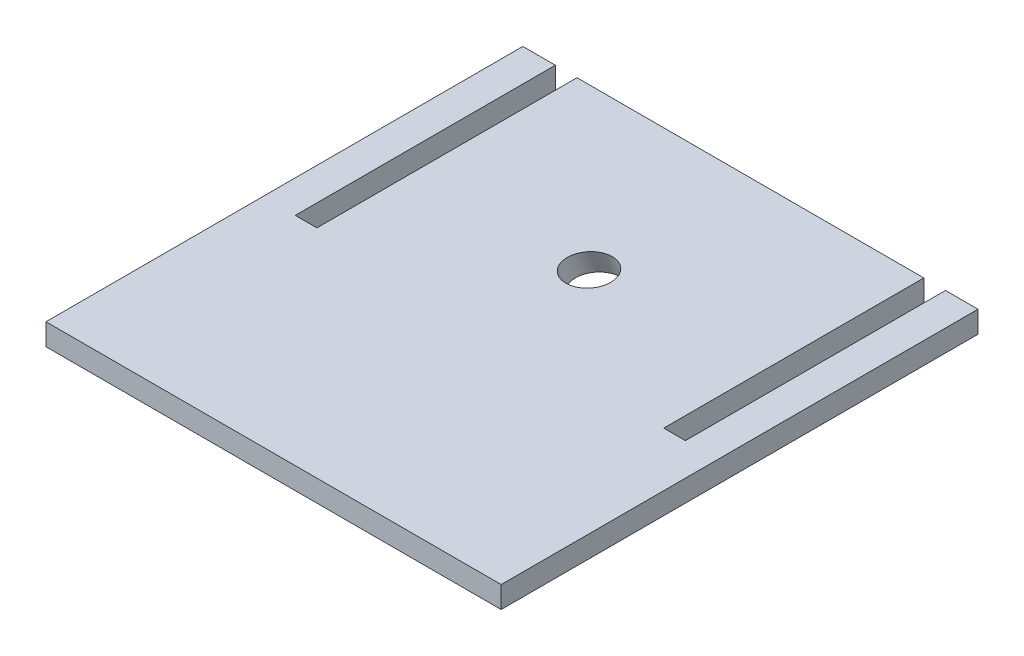
from build123d import *

# Parameters (mm, degrees)
SKETCH1_W           = 330.2
SKETCH1_H           = 279.4
BOSS_EXTRUDE1_DEPTH = 6.35
SKETCH2_W           = 12.7
SKETCH2_H           = 152.4
CUT_EXTRUDE1_DEPTH  = 217.645770787
SKETCH4_W           = 31.75
SKETCH4_H           = 279.4
CUT_EXTRUDE3_DEPTH  = 217.645770787
CAVITY1_START       = 5.359214582
CAVITY1_OUTLINE_R   = 12.7
CAVITY1_DEPTH       = 23.121998378


# Read off the part's stored shape, not the designer's step: Cavity1
with BuildPart() as part:
    # Sketch1 → Boss-Extrude1 (new, symmetric)
    with BuildSketch(Plane(origin=(0, 0, 0), x_dir=(1, 0, 0), z_dir=(0, 1, 0))):
        Rectangle(SKETCH1_W, SKETCH1_H)
    extrude(amount=BOSS_EXTRUDE1_DEPTH, both=True)

    # Sketch2 → Cut-Extrude1 (cut, through all)
    with BuildSketch(Plane(origin=(0, 6.35, 0), x_dir=(1, 0, 0), z_dir=(0, 1, 0))):
        with Locations((-107.95, 63.5)):
            Rectangle(SKETCH2_W, SKETCH2_H)
        with Locations((107.95, 63.5)):
            Rectangle(SKETCH2_W, SKETCH2_H)
    extrude(amount=-CUT_EXTRUDE1_DEPTH, mode=Mode.SUBTRACT)

    # Sketch4 → Cut-Extrude3 (cut, through all)
    with BuildSketch(Plane(origin=(0, 6.35, 0), x_dir=(1, 0, 0), z_dir=(0, 1, 0))):
        with Locations((-149.225, 0)):
            Rectangle(SKETCH4_W, SKETCH4_H)
        with Locations((149.225, 0)):
            Rectangle(SKETCH4_W, SKETCH4_H)
    extrude(amount=-CUT_EXTRUDE3_DEPTH, mode=Mode.SUBTRACT)

    # Cavity1 outline → Cavity1 (cut)
    with BuildSketch(Plane(origin=(0, 0, 0), x_dir=(0.9999723528488756, 0.006960139267343344, 0.002617250324818831), z_dir=(0.0074359624719049664, -0.9359846644758758, -0.35196223423557627)).offset(CAVITY1_START)):
        with Locations((-0.653273782, -45.008151356)):
            Circle(CAVITY1_OUTLINE_R)
    extrude(amount=CAVITY1_DEPTH, mode=Mode.SUBTRACT)


solid = part.part
